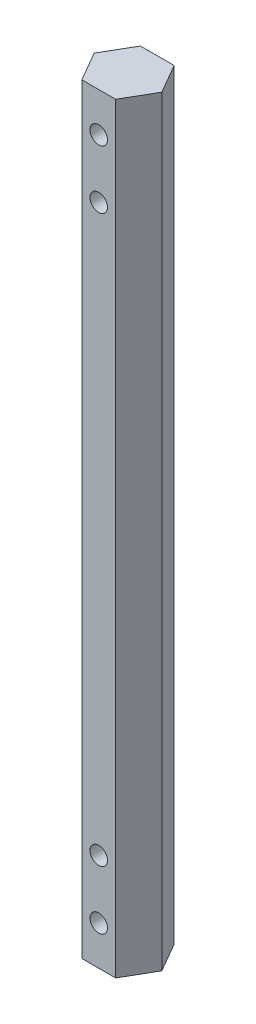
from build123d import *

# Parameters (mm, degrees)
BOSS_EXTRUDE1_DEPTH        = 165.1
TAP_DRILL_FOR_10_24_TAP2_D = 3.7973


with BuildPart() as part:
    # Sketch1 → Boss-Extrude1 (new body)
    with BuildSketch(Plane(origin=(0, 0, 0), x_dir=(1, 0, 0), z_dir=(0, 1, 0))):
        Polygon((7.332348419, 0), (3.666174209, 6.35), (-3.666174209, 6.35), (-7.332348419, 0), (-3.666174209, -6.35), (3.666174209, -6.35), align=None)
    extrude(amount=BOSS_EXTRUDE1_DEPTH)

    # Tap Drill for #10-24 Tap2 (through all)
    with Locations(Plane.XY.offset(6.35)):
        with Locations((0, 156.6), (0, 143.9), (0, 8.5), (0, 21.2)):
            Hole(TAP_DRILL_FOR_10_24_TAP2_D / 2)


solid = part.part
